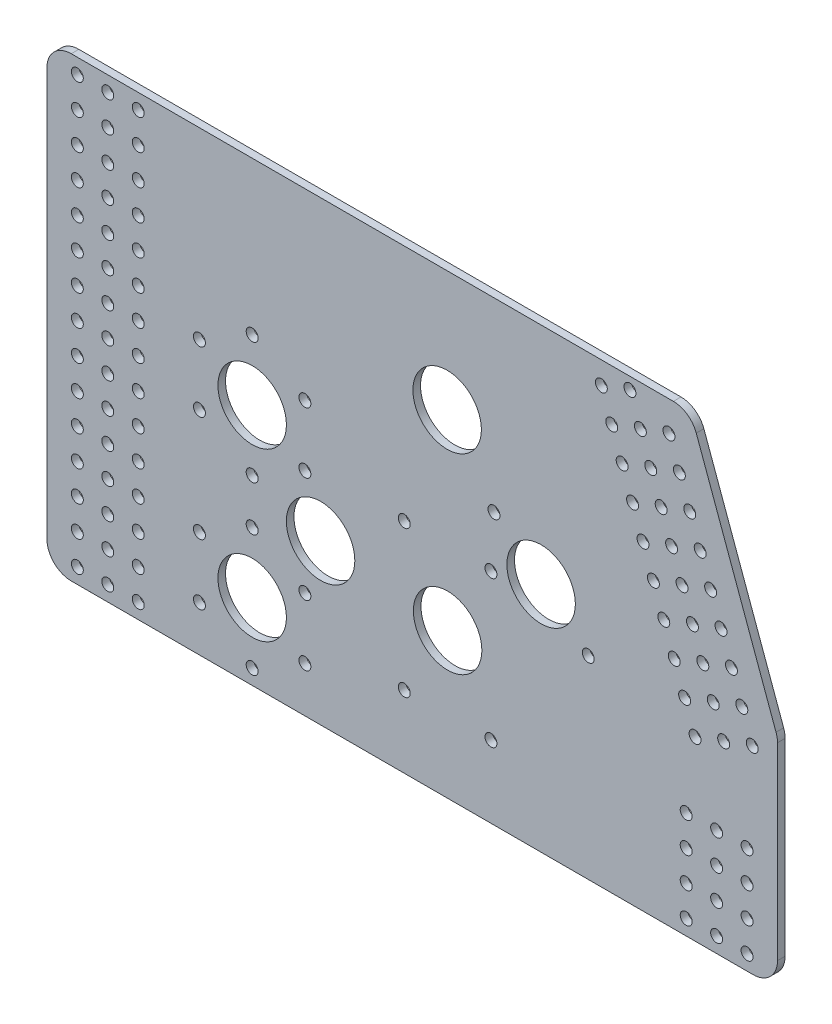
from build123d import *

# Parameters (mm, degrees)
SKETCH6_R           = 2.4892
SKETCH6_R_2         = 14.2875
BOSS_EXTRUDE1_DEPTH = 3.175
FILLET1_R           = 10.16


with BuildPart() as part:
    # Sketch6 → Boss-Extrude1 (new body)
    with BuildSketch(Plane.XY):
        Polygon((-62.034734806, 275.060295422), (206.435304788, 275.060295422), (242.765265194, 175.244549557), (242.765265194, 84.560295422), (-62.034734806, 84.560295422), align=None)
        with Locations((123.22406409, 114.608841068)):
            Circle(SKETCH6_R, mode=Mode.SUBTRACT)
        with Locations((87.05446409, 114.608841068)):
            Circle(SKETCH6_R, mode=Mode.SUBTRACT)
        with Locations((-49.334734806, 268.710295422)):
            Circle(SKETCH6_R, mode=Mode.SUBTRACT)
        with Locations((-49.334734806, 90.910295422)):
            Circle(SKETCH6_R, mode=Mode.SUBTRACT)
        with Locations((-36.634734806, 268.710295422)):
            Circle(SKETCH6_R, mode=Mode.SUBTRACT)
        with Locations((-23.934734806, 268.710295422)):
            Circle(SKETCH6_R, mode=Mode.SUBTRACT)
        with Locations((-36.634734806, 256.010295422)):
            Circle(SKETCH6_R, mode=Mode.SUBTRACT)
        with Locations((-23.934734806, 256.010295422)):
            Circle(SKETCH6_R, mode=Mode.SUBTRACT)
        with Locations((-36.634734806, 243.310295422)):
            Circle(SKETCH6_R, mode=Mode.SUBTRACT)
        with Locations((-23.934734806, 243.310295422)):
            Circle(SKETCH6_R, mode=Mode.SUBTRACT)
        with Locations((-36.634734806, 230.610295422)):
            Circle(SKETCH6_R, mode=Mode.SUBTRACT)
        with Locations((-23.934734806, 230.610295422)):
            Circle(SKETCH6_R, mode=Mode.SUBTRACT)
        with Locations((-36.634734806, 217.910295422)):
            Circle(SKETCH6_R, mode=Mode.SUBTRACT)
        with Locations((-23.934734806, 217.910295422)):
            Circle(SKETCH6_R, mode=Mode.SUBTRACT)
        with Locations((-36.634734806, 205.210295422)):
            Circle(SKETCH6_R, mode=Mode.SUBTRACT)
        with Locations((-23.934734806, 205.210295422)):
            Circle(SKETCH6_R, mode=Mode.SUBTRACT)
        with Locations((-36.634734806, 192.510295422)):
            Circle(SKETCH6_R, mode=Mode.SUBTRACT)
        with Locations((-23.934734806, 192.510295422)):
            Circle(SKETCH6_R, mode=Mode.SUBTRACT)
        with Locations((-36.634734806, 179.810295422)):
            Circle(SKETCH6_R, mode=Mode.SUBTRACT)
        with Locations((-23.934734806, 179.810295422)):
            Circle(SKETCH6_R, mode=Mode.SUBTRACT)
        with Locations((-36.634734806, 167.110295422)):
            Circle(SKETCH6_R, mode=Mode.SUBTRACT)
        with Locations((-23.934734806, 167.110295422)):
            Circle(SKETCH6_R, mode=Mode.SUBTRACT)
        with Locations((-36.634734806, 154.410295422)):
            Circle(SKETCH6_R, mode=Mode.SUBTRACT)
        with Locations((-23.934734806, 154.410295422)):
            Circle(SKETCH6_R, mode=Mode.SUBTRACT)
        with Locations((-36.634734806, 141.710295422)):
            Circle(SKETCH6_R, mode=Mode.SUBTRACT)
        with Locations((-23.934734806, 141.710295422)):
            Circle(SKETCH6_R, mode=Mode.SUBTRACT)
        with Locations((-36.634734806, 129.010295422)):
            Circle(SKETCH6_R, mode=Mode.SUBTRACT)
        with Locations((-23.934734806, 129.010295422)):
            Circle(SKETCH6_R, mode=Mode.SUBTRACT)
        with Locations((-36.634734806, 116.310295422)):
            Circle(SKETCH6_R, mode=Mode.SUBTRACT)
        with Locations((-23.934734806, 116.310295422)):
            Circle(SKETCH6_R, mode=Mode.SUBTRACT)
        with Locations((-36.634734806, 103.610295422)):
            Circle(SKETCH6_R, mode=Mode.SUBTRACT)
        with Locations((-23.934734806, 103.610295422)):
            Circle(SKETCH6_R, mode=Mode.SUBTRACT)
        with Locations((-36.634734806, 90.910295422)):
            Circle(SKETCH6_R, mode=Mode.SUBTRACT)
        with Locations((-23.934734806, 90.910295422)):
            Circle(SKETCH6_R, mode=Mode.SUBTRACT)
        with Locations((-49.334734806, 256.010295422)):
            Circle(SKETCH6_R, mode=Mode.SUBTRACT)
        with Locations((-49.334734806, 243.310295422)):
            Circle(SKETCH6_R, mode=Mode.SUBTRACT)
        with Locations((-49.334734806, 230.610295422)):
            Circle(SKETCH6_R, mode=Mode.SUBTRACT)
        with Locations((-49.334734806, 217.910295422)):
            Circle(SKETCH6_R, mode=Mode.SUBTRACT)
        with Locations((-49.334734806, 205.210295422)):
            Circle(SKETCH6_R, mode=Mode.SUBTRACT)
        with Locations((-49.334734806, 192.510295422)):
            Circle(SKETCH6_R, mode=Mode.SUBTRACT)
        with Locations((-49.334734806, 179.810295422)):
            Circle(SKETCH6_R, mode=Mode.SUBTRACT)
        with Locations((-49.334734806, 167.110295422)):
            Circle(SKETCH6_R, mode=Mode.SUBTRACT)
        with Locations((-49.334734806, 154.410295422)):
            Circle(SKETCH6_R, mode=Mode.SUBTRACT)
        with Locations((-49.334734806, 141.710295422)):
            Circle(SKETCH6_R, mode=Mode.SUBTRACT)
        with Locations((-49.334734806, 129.010295422)):
            Circle(SKETCH6_R, mode=Mode.SUBTRACT)
        with Locations((-49.334734806, 116.310295422)):
            Circle(SKETCH6_R, mode=Mode.SUBTRACT)
        with Locations((-49.334734806, 103.610295422)):
            Circle(SKETCH6_R, mode=Mode.SUBTRACT)
        with Locations((169.26865969, 265.77786594)):
            Circle(SKETCH6_R, mode=Mode.SUBTRACT)
        with Locations((181.202755974, 270.121521761)):
            Circle(SKETCH6_R, mode=Mode.SUBTRACT)
        with Locations((197.480508078, 262.531081297)):
            Circle(SKETCH6_R, mode=Mode.SUBTRACT)
        with Locations((173.61231551, 253.843769656)):
            Circle(SKETCH6_R, mode=Mode.SUBTRACT)
        with Locations((185.546411794, 258.187425477)):
            Circle(SKETCH6_R, mode=Mode.SUBTRACT)
        with Locations((201.824163899, 250.596985013)):
            Circle(SKETCH6_R, mode=Mode.SUBTRACT)
        with Locations((177.955971331, 241.909673372)):
            Circle(SKETCH6_R, mode=Mode.SUBTRACT)
        with Locations((189.890067615, 246.253329193)):
            Circle(SKETCH6_R, mode=Mode.SUBTRACT)
        with Locations((206.167819719, 238.662888729)):
            Circle(SKETCH6_R, mode=Mode.SUBTRACT)
        with Locations((182.299627151, 229.975577088)):
            Circle(SKETCH6_R, mode=Mode.SUBTRACT)
        with Locations((194.233723435, 234.319232909)):
            Circle(SKETCH6_R, mode=Mode.SUBTRACT)
        with Locations((210.511475539, 226.728792445)):
            Circle(SKETCH6_R, mode=Mode.SUBTRACT)
        with Locations((186.643282971, 218.041480804)):
            Circle(SKETCH6_R, mode=Mode.SUBTRACT)
        with Locations((198.577379255, 222.385136625)):
            Circle(SKETCH6_R, mode=Mode.SUBTRACT)
        with Locations((214.855131359, 214.794696161)):
            Circle(SKETCH6_R, mode=Mode.SUBTRACT)
        with Locations((190.986938791, 206.10738452)):
            Circle(SKETCH6_R, mode=Mode.SUBTRACT)
        with Locations((202.921035075, 210.451040341)):
            Circle(SKETCH6_R, mode=Mode.SUBTRACT)
        with Locations((219.19878718, 202.860599877)):
            Circle(SKETCH6_R, mode=Mode.SUBTRACT)
        with Locations((195.330594612, 194.173288236)):
            Circle(SKETCH6_R, mode=Mode.SUBTRACT)
        with Locations((207.264690896, 198.516944057)):
            Circle(SKETCH6_R, mode=Mode.SUBTRACT)
        with Locations((223.542443, 190.926503593)):
            Circle(SKETCH6_R, mode=Mode.SUBTRACT)
        with Locations((199.674250432, 182.239191952)):
            Circle(SKETCH6_R, mode=Mode.SUBTRACT)
        with Locations((211.608346716, 186.582847773)):
            Circle(SKETCH6_R, mode=Mode.SUBTRACT)
        with Locations((227.88609882, 178.992407309)):
            Circle(SKETCH6_R, mode=Mode.SUBTRACT)
        with Locations((204.017906252, 170.305095668)):
            Circle(SKETCH6_R, mode=Mode.SUBTRACT)
        with Locations((215.952002536, 174.648751489)):
            Circle(SKETCH6_R, mode=Mode.SUBTRACT)
        with Locations((232.22975464, 167.058311025)):
            Circle(SKETCH6_R, mode=Mode.SUBTRACT)
        with Locations((208.361562072, 158.370999384)):
            Circle(SKETCH6_R, mode=Mode.SUBTRACT)
        with Locations((220.295658356, 162.714655205)):
            Circle(SKETCH6_R, mode=Mode.SUBTRACT)
        with Locations((204.665265194, 129.010295422)):
            Circle(SKETCH6_R, mode=Mode.SUBTRACT)
        with Locations((217.365265194, 129.010295422)):
            Circle(SKETCH6_R, mode=Mode.SUBTRACT)
        with Locations((230.065265194, 129.010295422)):
            Circle(SKETCH6_R, mode=Mode.SUBTRACT)
        with Locations((204.665265194, 116.310295422)):
            Circle(SKETCH6_R, mode=Mode.SUBTRACT)
        with Locations((217.365265194, 116.310295422)):
            Circle(SKETCH6_R, mode=Mode.SUBTRACT)
        with Locations((230.065265194, 116.310295422)):
            Circle(SKETCH6_R, mode=Mode.SUBTRACT)
        with Locations((204.665265194, 103.610295422)):
            Circle(SKETCH6_R, mode=Mode.SUBTRACT)
        with Locations((217.365265194, 103.610295422)):
            Circle(SKETCH6_R, mode=Mode.SUBTRACT)
        with Locations((230.065265194, 103.610295422)):
            Circle(SKETCH6_R, mode=Mode.SUBTRACT)
        with Locations((204.665265194, 90.910295422)):
            Circle(SKETCH6_R, mode=Mode.SUBTRACT)
        with Locations((217.365265194, 90.910295422)):
            Circle(SKETCH6_R, mode=Mode.SUBTRACT)
        with Locations((230.065265194, 90.910295422)):
            Circle(SKETCH6_R, mode=Mode.SUBTRACT)
        with Locations((23.601611853, 185.85256672)):
            Circle(SKETCH6_R_2, mode=Mode.SUBTRACT)
        with Locations((52.142163008, 151.05639055)):
            Circle(SKETCH6_R_2, mode=Mode.SUBTRACT)
        with Locations((23.601611853, 116.25656672)):
            Circle(SKETCH6_R_2, mode=Mode.SUBTRACT)
        with Locations((105.13926409, 145.139641068)):
            Circle(SKETCH6_R_2, mode=Mode.SUBTRACT)
        with Locations((104.944740556, 224.82726801)):
            Circle(SKETCH6_R_2, mode=Mode.SUBTRACT)
        with Locations((144.142354475, 181.392565924)):
            Circle(SKETCH6_R_2, mode=Mode.SUBTRACT)
        with Locations((23.601611853, 141.65656672)):
            Circle(SKETCH6_R, mode=Mode.SUBTRACT)
        with Locations((45.598657109, 128.95656672)):
            Circle(SKETCH6_R, mode=Mode.SUBTRACT)
        with Locations((45.598657109, 103.55656672)):
            Circle(SKETCH6_R, mode=Mode.SUBTRACT)
        with Locations((23.601611853, 90.85656672)):
            Circle(SKETCH6_R, mode=Mode.SUBTRACT)
        with Locations((1.604566597, 103.55656672)):
            Circle(SKETCH6_R, mode=Mode.SUBTRACT)
        with Locations((1.604566597, 128.95656672)):
            Circle(SKETCH6_R, mode=Mode.SUBTRACT)
        with Locations((23.601611853, 211.25256672)):
            Circle(SKETCH6_R, mode=Mode.SUBTRACT)
        with Locations((45.598657109, 198.55256672)):
            Circle(SKETCH6_R, mode=Mode.SUBTRACT)
        with Locations((45.598657109, 173.15256672)):
            Circle(SKETCH6_R, mode=Mode.SUBTRACT)
        with Locations((23.601611853, 160.45256672)):
            Circle(SKETCH6_R, mode=Mode.SUBTRACT)
        with Locations((1.604566597, 173.15256672)):
            Circle(SKETCH6_R, mode=Mode.SUBTRACT)
        with Locations((1.604566597, 198.55256672)):
            Circle(SKETCH6_R, mode=Mode.SUBTRACT)
        with Locations((123.22406409, 175.670441068)):
            Circle(SKETCH6_R, mode=Mode.SUBTRACT)
        with Locations((87.05446409, 175.670441068)):
            Circle(SKETCH6_R, mode=Mode.SUBTRACT)
        with Locations((124.481635338, 197.576114931)):
            Circle(SKETCH6_R, mode=Mode.SUBTRACT)
        with Locations((163.804134526, 165.414319931)):
            Circle(SKETCH6_R, mode=Mode.SUBTRACT)
    extrude(amount=BOSS_EXTRUDE1_DEPTH)

    # Fillet1
    fillet1_edges = [part.edges().sort_by_distance(p)[0] for p in [
        (242.765265194, 84.560295422, 1.5875),
        (242.765265194, 175.244549557, 1.5875),
        (206.435304788, 275.060295422, 1.5875),
        (-62.034734806, 84.560295422, 1.5875),
        (-62.034734806, 275.060295422, 1.5875),
    ]]
    fillet(fillet1_edges, radius=FILLET1_R)


solid = part.part
